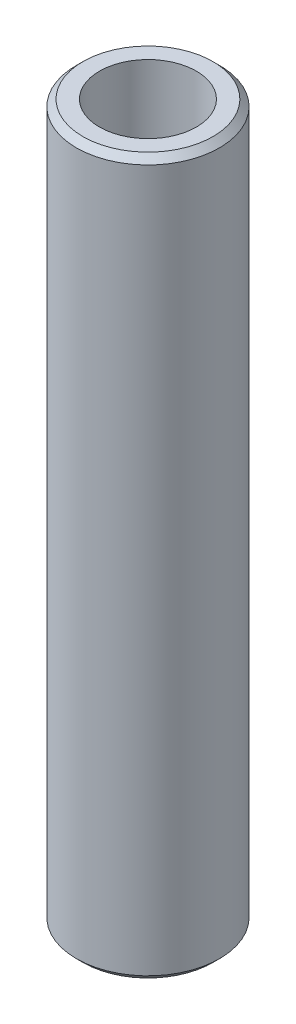
from build123d import *

# Parameters (mm, degrees)
SKETCH1_R           = 60
BOSS_EXTRUDE1_DEPTH = 600
SKETCH2_R           = 40.655468251
CUT_EXTRUDE1_DEPTH  = 606.970296302
CHAMFER1_SIZE       = 5.455033659


with BuildPart() as part:
    # Sketch1 → Boss-Extrude1 (new body)
    with BuildSketch(Plane(origin=(0, 0, 0), x_dir=(1, 0, 0), z_dir=(0, 1, 0))):
        Circle(SKETCH1_R)
    extrude(amount=BOSS_EXTRUDE1_DEPTH)

    # Sketch2 → Cut-Extrude1 (cut, through all)
    with BuildSketch(Plane(origin=(0, 0, 0), x_dir=(1, 0, 0), z_dir=(0, 1, 0))):
        Circle(SKETCH2_R)
    extrude(amount=CUT_EXTRUDE1_DEPTH, mode=Mode.SUBTRACT)

    # Chamfer1
    chamfer1_edges = [part.edges().sort_by_distance(p)[0] for p in [
        (-60, 600, 0),
        (-60, 0, 0),
    ]]
    chamfer(chamfer1_edges, length=CHAMFER1_SIZE)


solid = part.part
